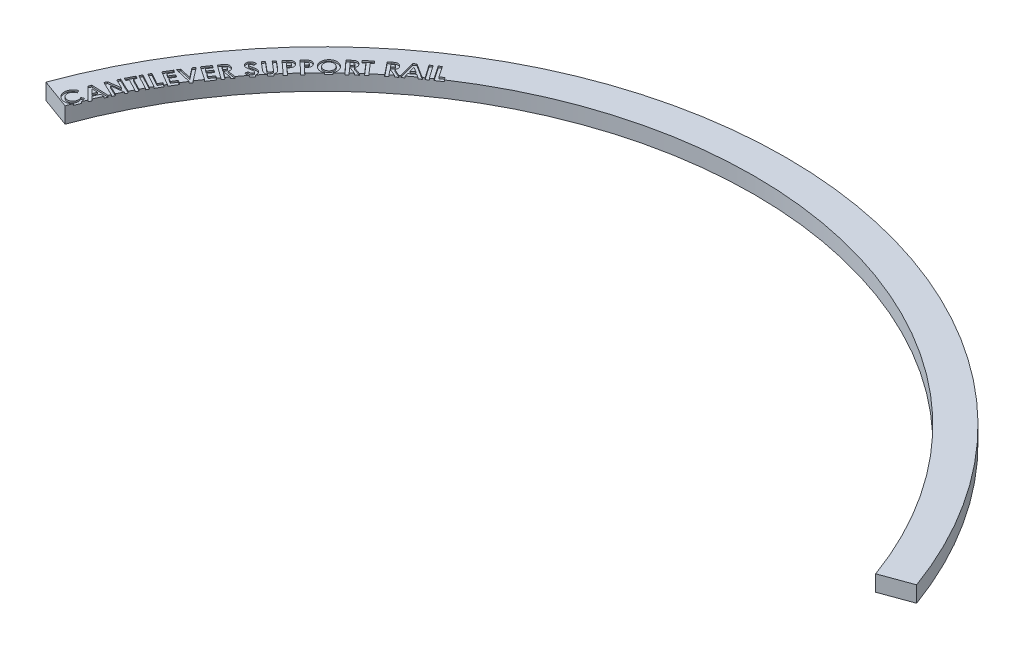
from build123d import *

# Parameters (mm, degrees)
BOSS_EXTRUDE1_DEPTH = 12.7
CUT_EXTRUDE1_DEPTH  = 1.27


with BuildPart() as part:
    # Sketch1 → Boss-Extrude1 (new body)
    with BuildSketch(Plane(origin=(0, 0, 0), x_dir=(1, 0, 0), z_dir=(0, 1, 0))):
        with BuildLine():
            Line((-346.088792235, 125.966018787), (-322.220599667, 117.278707146))
            ThreePointArc((-322.220599667, 117.278707146), (0, 342.9), (322.220599667, 117.278707146))
            Line((322.220599667, 117.278707146), (346.088792235, 125.966018787))
            ThreePointArc((346.088792235, 125.966018787), (0, 368.3), (-346.088792235, 125.966018787))
        make_face()
    extrude(amount=BOSS_EXTRUDE1_DEPTH)

    # Sketch2 → Cut-Extrude1 (cut)
    # profile 1 of 21: a face of its own
    with BuildSketch(Plane(origin=(0, 12.7, 0), x_dir=(1, 0, 0), z_dir=(0, 1, 0))):
        with BuildLine():
            Line((-327.240050789, 133.240205544), (-326.347082039, 131.08792189))
            add(Edge.make_bspline(
                [(-326.347082039, 131.08792189), (-326.533576349, 131.006455917), (-326.898014242, 130.847259168), (-327.405952395, 130.557291605), (-327.867090749, 130.236773155), (-328.27919524, 129.88071122), (-328.645174833, 129.494147103), (-328.960230288, 129.071770204), (-329.231837871, 128.618914855), (-329.36740769, 128.29304351), (-329.435583642, 128.129167884)],
                knots=[0, 0, 0, 0, 1.108760181, 2.166683935, 3.182414968, 4.165710305, 5.130476593, 6.078168, 7.033540604, 8, 8, 8, 8], degree=3))
            add(Edge.make_bspline(
                [(-329.435583642, 128.129167884), (-329.485956587, 127.98927305), (-329.585079401, 127.713990958), (-329.682229684, 127.291386266), (-329.743783374, 126.87360138), (-329.755052747, 126.457251824), (-329.726863801, 126.044171553), (-329.659723244, 125.632416644), (-329.541287363, 125.225614219), (-329.389328213, 124.824130749), (-329.195321735, 124.440810278), (-328.976092531, 124.078983957), (-328.718268106, 123.751819338), (-328.432079104, 123.452743406), (-328.116407213, 123.181354521), (-327.766135575, 122.944298119), (-327.387647445, 122.734160909), (-327.117446656, 122.622072636), (-326.980555597, 122.565285672)],
                knots=[0, 0, 0, 0, 1.051327752, 2.06878049, 3.062580169, 4.035209371, 5.009614187, 5.989271401, 6.980912635, 8.002885837, 9.022707255, 10.016959793, 10.99171565, 11.96367816, 12.942636682, 13.931350166, 14.951965803, 16, 16, 16, 16], degree=3))
            add(Edge.make_bspline(
                [(-326.980555597, 122.565285672), (-326.786941462, 122.497534046), (-326.408036175, 122.364943265), (-325.825028608, 122.254098005), (-325.251319029, 122.216139101), (-324.780723673, 122.25138289), (-324.413720597, 122.314215688), (-324.146146698, 122.38530296), (-323.883017638, 122.467061172), (-323.629894483, 122.57276871), (-323.382460119, 122.692452371), (-323.14382551, 122.83372949), (-322.909766246, 122.990093782), (-322.610688276, 123.226310864), (-322.262599485, 123.555146589), (-321.900759728, 124.006977094), (-321.59150435, 124.507138782), (-321.436657148, 124.871316479), (-321.358159764, 125.055930704)],
                knots=[0, 0, 0, 0, 1.427589606, 2.793810731, 4.119924572, 5.423254632, 6.071185623, 6.711773999, 7.350834564, 7.989430606, 8.620990168, 9.264487668, 9.919998623, 10.580734758, 11.918121045, 13.245997584, 14.60390126, 16, 16, 16, 16], degree=3))
            add(Edge.make_bspline(
                [(-321.358159764, 125.055930704), (-321.300135758, 125.217639294), (-321.186323729, 125.53482496), (-321.081996838, 126.023028796), (-321.022482983, 126.505988231), (-321.024114413, 126.90952417), (-321.050590622, 127.23627958), (-321.08903288, 127.492915625), (-321.146991965, 127.761454578), (-321.216742464, 128.043041758), (-321.307712155, 128.33591295), (-321.411564195, 128.641822115), (-321.533855303, 128.960047714), (-321.626222471, 129.174249422), (-321.673624507, 129.284175896)],
                knots=[0, 0, 0, 0, 1.414032219, 2.773574057, 4.102998339, 5.416519823, 6.089579107, 6.802987462, 7.552533178, 8.352363461, 9.192235755, 10.078240111, 11.013769348, 12, 12, 12, 12], degree=3))
            Line((-321.673624507, 129.284175896), (-319.493356078, 130.19495314))
            add(Edge.make_bspline(
                [(-319.493356078, 130.19495314), (-319.432306776, 130.047739768), (-319.312666486, 129.759240962), (-319.151522281, 129.330689657), (-319.017548518, 128.914009531), (-318.900426085, 128.512799253), (-318.813442848, 128.123080384), (-318.741902932, 127.749402357), (-318.699798263, 127.38883208), (-318.675801056, 127.03985273), (-318.673358685, 126.695778973), (-318.691351378, 126.350047435), (-318.730326961, 126.000369373), (-318.785583208, 125.646026911), (-318.86299391, 125.287854358), (-318.960014154, 124.925711192), (-319.073763993, 124.557561836), (-319.164789389, 124.314331352), (-319.210964251, 124.19094673)],
                knots=[0, 0, 0, 0, 1.234967501, 2.420205749, 3.546559319, 4.626144769, 5.657554192, 6.639722168, 7.573012089, 8.468689078, 9.349292802, 10.237635295, 11.149841904, 12.07464878, 13.015542472, 13.987878246, 14.979301945, 16, 16, 16, 16], degree=3))
            add(Edge.make_bspline(
                [(-319.210964251, 124.19094673), (-319.303025591, 123.968730948), (-319.483568928, 123.53293913), (-319.814155154, 122.919202545), (-320.187233991, 122.357846153), (-320.60626267, 121.851194025), (-321.061099878, 121.391001717), (-321.566865187, 120.991594138), (-322.11171299, 120.640512115), (-322.693918316, 120.344680091), (-323.30252608, 120.108787674), (-323.925355626, 119.936479528), (-324.558431493, 119.834307297), (-325.200345198, 119.799799683), (-325.852550609, 119.826871555), (-326.514429137, 119.925921468), (-327.18554636, 120.091072762), (-327.626297739, 120.248779451), (-327.850627712, 120.329047691)],
                knots=[0, 0, 0, 0, 1.086668448, 2.131087251, 3.14530151, 4.128353758, 5.098686764, 6.064283892, 7.035040782, 8.024172257, 9.010775273, 9.980676634, 10.939792684, 11.903402036, 12.88175745, 13.885164845, 14.923608779, 16, 16, 16, 16], degree=3))
            add(Edge.make_bspline(
                [(-327.850627712, 120.329047691), (-327.994702083, 120.387526013), (-328.279729896, 120.503215905), (-328.689204476, 120.70492337), (-329.077496645, 120.926740639), (-329.443324332, 121.168587932), (-329.789688283, 121.427778989), (-330.109112312, 121.712255749), (-330.412138487, 122.011923907), (-330.688084612, 122.336029619), (-330.942430898, 122.675243531), (-331.170274617, 123.032034362), (-331.373104821, 123.402720566), (-331.553153908, 123.788861819), (-331.703675854, 124.191199328), (-331.835951622, 124.60640019), (-331.935592624, 125.038245917), (-332.01502845, 125.48038852), (-332.066255251, 125.929891996), (-332.085855793, 126.379503956), (-332.078620679, 126.826451924), (-332.042517504, 127.269933277), (-331.980174603, 127.710575086), (-331.883496728, 128.147473413), (-331.764253447, 128.582960145), (-331.658705111, 128.866806786), (-331.605675789, 129.009416281)],
                knots=[0, 0, 0, 0, 1.060195787, 2.097425703, 3.110360843, 4.108123557, 5.086726685, 6.057918386, 7.023081055, 7.99104697, 8.958079373, 9.912682834, 10.875555342, 11.838167259, 12.815658834, 13.803464982, 14.807910485, 15.83581039, 16.866034485, 17.890789188, 18.903080162, 19.912690968, 20.92365929, 21.93555365, 22.962786209, 24, 24, 24, 24], degree=3))
            add(Edge.make_bspline(
                [(-331.605675789, 129.009416281), (-331.55707032, 129.130459189), (-331.460396816, 129.37120662), (-331.290414138, 129.720309905), (-331.105292849, 130.060120105), (-330.898820126, 130.386877965), (-330.676750334, 130.703837105), (-330.437423729, 131.010455174), (-330.177123259, 131.304043375), (-329.903826558, 131.589352526), (-329.614017752, 131.858411434), (-329.310936182, 132.110809354), (-328.994869581, 132.345039096), (-328.667506907, 132.561636808), (-328.327032999, 132.756577728), (-327.97845242, 132.939996796), (-327.614110075, 133.09868934), (-327.365107794, 133.192893277), (-327.240050789, 133.240205544)],
                knots=[0, 0, 0, 0, 0.998053449, 1.98507131, 2.969803044, 3.95846279, 4.941631779, 5.931015647, 6.933596394, 7.943462034, 8.953828145, 9.958549592, 10.960710057, 11.963416854, 12.960900307, 13.962430021, 14.976666403, 16, 16, 16, 16], degree=3))
        make_face()
    # profile 2 of 21: a face of its own
    with BuildSketch(Plane(origin=(0, 12.7, 0), x_dir=(1, 0, 0), z_dir=(0, 1, 0))):
        Polygon((-326.767099015, 139.892128098), (-325.80035222, 142.125822009), (-312.296425938, 141.571214637), (-313.286069367, 139.281551175), (-316.061650297, 139.40621063), (-318.104538919, 134.684415759), (-316.130340201, 132.710217041), (-317.11998363, 130.420553579), align=None)
        Polygon((-323.207944367, 139.696234669), (-319.900652701, 136.434736271), (-318.567559752, 139.513061592), align=None, mode=Mode.SUBTRACT)
    # profile 3 of 21: a face of its own
    with BuildSketch(Plane(origin=(0, 12.7, 0), x_dir=(1, 0, 0), z_dir=(0, 1, 0))):
        Polygon((-322.843899855, 148.703641282), (-321.856800496, 150.771970609), (-312.072305304, 152.077078782), (-319.536608188, 155.63623343), (-318.506259631, 157.796149295), (-307.162249214, 152.384911314), (-308.149348573, 150.311493846), (-317.910947131, 149.001297532), (-310.469540881, 145.452319167), (-311.499889438, 143.292403302), align=None)
    # profile 4 of 21: a face of its own
    with BuildSketch(Plane(origin=(0, 12.7, 0), x_dir=(1, 0, 0), z_dir=(0, 1, 0))):
        Polygon((-317.638394433, 159.712022148), (-314.435409657, 165.917010129), (-312.328919273, 164.83069202), (-313.384708536, 162.785259327), (-304.264215747, 158.076184808), (-305.383606773, 155.908636731), (-314.504099561, 160.617711251), (-315.531904048, 158.625704039), align=None)
    # profile 5 of 21: a face of its own
    with BuildSketch(Plane(origin=(0, 12.7, 0), x_dir=(1, 0, 0), z_dir=(0, 1, 0))):
        Polygon((-313.657843545, 167.35252087), (-312.525732166, 169.453923113), (-301.415776237, 163.472813338), (-302.547887615, 161.371411094), align=None)
    # profile 6 of 21: a face of its own
    with BuildSketch(Plane(origin=(0, 12.7, 0), x_dir=(1, 0, 0), z_dir=(0, 1, 0))):
        Polygon((-311.122814513, 171.982993518), (-309.947453936, 174.07421948), (-300.949076532, 169.024239512), (-299.236917077, 172.074580056), (-297.242365795, 170.955189031), (-300.129885827, 165.813622524), align=None)
    # profile 7 of 21: a face of its own
    with BuildSketch(Plane(origin=(0, 12.7, 0), x_dir=(1, 0, 0), z_dir=(0, 1, 0))):
        Polygon((-307.139536895, 179.075609285), (-303.615999234, 185.013469862), (-301.590919106, 183.81266858), (-303.895846991, 179.930416977), (-301.929280484, 178.762688612), (-299.6243526, 182.644940214), (-297.634889459, 181.461947426), (-299.939817343, 177.579695823), (-297.077738016, 175.880256721), (-294.772810132, 179.762508323), (-292.740097792, 178.5566189), (-296.263635452, 172.618758323), align=None)
    # profile 8 of 21: a face of its own
    with BuildSketch(Plane(origin=(0, 12.7, 0), x_dir=(1, 0, 0), z_dir=(0, 1, 0))):
        Polygon((-302.729985797, 186.387821602), (-301.40198099, 188.471415352), (-292.136476182, 186.33185205), (-297.967485797, 193.862300768), (-296.64202506, 195.945894518), (-288.442485797, 185.334576409), (-289.686536278, 183.380730256), align=None)
    # profile 9 of 21: a face of its own
    with BuildSketch(Plane(origin=(0, 12.7, 0), x_dir=(1, 0, 0), z_dir=(0, 1, 0))):
        Polygon((-295.279942548, 197.933555814), (-291.405323156, 203.614465269), (-289.466741426, 202.291548602), (-292.000635656, 198.577205653), (-290.118023477, 197.292450044), (-287.584129246, 201.006792993), (-285.681164503, 199.709317032), (-288.215058733, 195.994974083), (-285.477638862, 194.127626326), (-282.943744631, 197.841969275), (-280.997530689, 196.513964467), (-284.87215008, 190.833055012), align=None)
    # profile 10 of 21: a face of its own
    with BuildSketch(Plane(origin=(0, 12.7, 0), x_dir=(1, 0, 0), z_dir=(0, 1, 0))):
        with BuildLine():
            Line((-289.781049484, 205.851150073), (-288.287680093, 207.906759048))
            add(Edge.make_bspline(
                [(-288.287680093, 207.906759048), (-288.188242426, 208.041219689), (-287.996505561, 208.300488262), (-287.709811974, 208.666862501), (-287.434499709, 208.995717757), (-287.173574884, 209.288801374), (-286.924689327, 209.54430771), (-286.687373625, 209.761323391), (-286.464808706, 209.944029908), (-286.248320489, 210.089536937), (-286.036716248, 210.209317847), (-285.820415937, 210.305529097), (-285.600274732, 210.388556073), (-285.372128471, 210.447692563), (-285.139842619, 210.496107268), (-284.900323437, 210.518883494), (-284.654761535, 210.531147717), (-284.319611057, 210.515550701), (-283.895299453, 210.456404481), (-283.393972216, 210.298654467), (-282.8989242, 210.067175375), (-282.591408226, 209.858287332), (-282.433773843, 209.751210169)],
                knots=[0, 0, 0, 0, 1.419960084, 2.737983553, 3.949417981, 5.061064723, 6.069250762, 6.976468474, 7.790645228, 8.511604153, 9.188613188, 9.852475166, 10.519958979, 11.183703793, 11.851653509, 12.532328685, 13.224185511, 13.937625959, 15.378554625, 16.847634656, 18.384080147, 20, 20, 20, 20], degree=3))
            add(Edge.make_bspline(
                [(-282.433773843, 209.751210169), (-282.353214497, 209.69035591), (-282.194970807, 209.570819158), (-281.976010492, 209.376567052), (-281.776817877, 209.175416261), (-281.598032394, 208.967044269), (-281.441653766, 208.75031184), (-281.309807437, 208.524216689), (-281.193482471, 208.293422381), (-281.102625314, 208.052541714), (-281.030119943, 207.805341739), (-280.982611082, 207.549537328), (-280.95473388, 207.28672065), (-280.946494836, 207.016159001), (-280.963163616, 206.73815145), (-280.998648969, 206.451583091), (-281.057094574, 206.157531729), (-281.111311065, 205.961082421), (-281.138841952, 205.861326355)],
                knots=[0, 0, 0, 0, 1.096733133, 2.154326055, 3.1773508, 4.170856757, 5.134953013, 6.076862685, 7.012349657, 7.939905927, 8.870250196, 9.808230052, 10.762766542, 11.739941671, 12.74589109, 13.78599658, 14.875739133, 16, 16, 16, 16], degree=3))
            Line((-281.138841952, 205.861326355), (-274.867708138, 204.981077958))
            Line((-274.867708138, 204.981077958), (-276.404326727, 202.864411291))
            Line((-276.404326727, 202.864411291), (-282.377804292, 203.706498631))
            Line((-282.377804292, 203.706498631), (-282.507551888, 203.528413695))
            Line((-282.507551888, 203.528413695), (-278.197896439, 200.396662894))
            Line((-278.197896439, 200.396662894), (-279.607311503, 198.458081163))
            Line((-279.607311503, 198.458081163), (-289.781049484, 205.851150073))
        make_face()
        with BuildLine():
            Line((-284.395252208, 204.899667701), (-283.952583939, 205.507700554))
            add(Edge.make_bspline(
                [(-283.952583939, 205.507700554), (-283.899532112, 205.582851309), (-283.798048755, 205.72660792), (-283.659354677, 205.938815622), (-283.541329453, 206.138415192), (-283.448815681, 206.327753361), (-283.368502962, 206.500617067), (-283.316760629, 206.664436687), (-283.277991795, 206.814370795), (-283.26114777, 206.997971515), (-283.287503006, 207.218579549), (-283.390934078, 207.470389943), (-283.57440285, 207.699934554), (-283.733469484, 207.826813872), (-283.817748202, 207.894038695)],
                knots=[0, 0, 0, 0, 1.202832052, 2.300909128, 3.314666972, 4.232145169, 5.056351339, 5.80330458, 6.475748144, 7.07713861, 8.20504816, 9.343862454, 10.59269124, 12, 12, 12, 12], degree=3))
            add(Edge.make_bspline(
                [(-283.817748202, 207.894038695), (-283.872766223, 207.930445747), (-283.98041277, 208.001678652), (-284.155362178, 208.079021674), (-284.335982568, 208.125118414), (-284.519621543, 208.142884633), (-284.702422342, 208.133005075), (-284.880441276, 208.09478941), (-285.050130752, 208.026338778), (-285.187642724, 207.949600726), (-285.298613443, 207.869649524), (-285.387519674, 207.78820133), (-285.486784634, 207.692289756), (-285.59309637, 207.577086328), (-285.707763246, 207.445508493), (-285.826664195, 207.293404207), (-285.956925546, 207.126515742), (-286.044143477, 207.007259225), (-286.08960317, 206.945100394)],
                knots=[0, 0, 0, 0, 1.12432441, 2.199818149, 3.245700022, 4.292482439, 5.335959061, 6.357738569, 7.38422064, 8.446786831, 9.037243688, 9.713803397, 10.501743855, 11.392468265, 12.387565934, 13.479099725, 14.686057435, 16, 16, 16, 16], degree=3))
            Line((-286.08960317, 206.945100394), (-286.476301888, 206.413389657))
            Line((-286.476301888, 206.413389657), (-284.395252208, 204.899667701))
        make_face(mode=Mode.SUBTRACT)
    # profile 11 of 21: a face of its own
    with BuildSketch(Plane(origin=(0, 12.7, 0), x_dir=(1, 0, 0), z_dir=(0, 1, 0))):
        with BuildLine():
            Line((-275.130264086, 222.508663829), (-275.00051649, 220.1299579))
            add(Edge.make_bspline(
                [(-275.00051649, 220.1299579), (-275.129424157, 220.134652183), (-275.377233101, 220.143676358), (-275.733673912, 220.122360149), (-276.059531041, 220.07886683), (-276.353690914, 220.004813678), (-276.617899854, 219.907070718), (-276.849616929, 219.780850686), (-277.053690985, 219.631103843), (-277.162462585, 219.507097226), (-277.216401907, 219.445602932)],
                knots=[0, 0, 0, 0, 1.286006536, 2.472187498, 3.557207052, 4.560436619, 5.492070806, 6.358893645, 7.186183128, 8, 8, 8, 8], degree=3))
            add(Edge.make_bspline(
                [(-277.216401907, 219.445602932), (-277.260567506, 219.383994418), (-277.345428948, 219.265617508), (-277.440662062, 219.074534567), (-277.492363509, 218.877885966), (-277.503996966, 218.682903973), (-277.485440622, 218.499111187), (-277.434983703, 218.334683523), (-277.352108523, 218.19429895), (-277.275124977, 218.122737351), (-277.236754471, 218.087069278)],
                knots=[0, 0, 0, 0, 1.210306979, 2.325529264, 3.390546432, 4.436247087, 5.431464978, 6.327229767, 7.166249885, 8, 8, 8, 8], degree=3))
            add(Edge.make_bspline(
                [(-277.236754471, 218.087069278), (-277.193598264, 218.056602437), (-277.107207658, 217.995613555), (-276.95920254, 217.932982602), (-276.799856383, 217.890038514), (-276.688378661, 217.884061664), (-276.631265689, 217.880999566)],
                knots=[0, 0, 0, 0, 0.972018067, 1.945797266, 2.947577858, 4, 4, 4, 4], degree=3))
            add(Edge.make_bspline(
                [(-276.631265689, 217.880999566), (-276.5837553, 217.88227663), (-276.474142477, 217.885222985), (-276.288226983, 217.901618637), (-276.057612789, 217.930693804), (-275.782743871, 217.971139084), (-275.463132873, 218.025426728), (-275.100435991, 218.092204847), (-274.692265143, 218.167997353), (-274.405986585, 218.224957276), (-274.25510383, 218.254977932)],
                knots=[0, 0, 0, 0, 0.473668386, 1.092816336, 1.859245285, 2.790493068, 3.861922217, 5.090514929, 6.466559537, 8, 8, 8, 8], degree=3))
            add(Edge.make_bspline(
                [(-274.25510383, 218.254977932), (-274.115176676, 218.283788427), (-273.849821761, 218.338424045), (-273.472929757, 218.416376903), (-273.136472674, 218.478399747), (-272.84251404, 218.535133527), (-272.590641101, 218.580959769), (-272.381238985, 218.616978088), (-272.21423434, 218.64320837), (-272.116419564, 218.654629611), (-272.0748354, 218.659485143)],
                knots=[0, 0, 0, 0, 1.545884822, 2.9315835, 4.164375646, 5.247790219, 6.171128417, 6.934465452, 7.547007459, 8, 8, 8, 8], degree=3))
            add(Edge.make_bspline(
                [(-272.0748354, 218.659485143), (-271.908768281, 218.674631476), (-271.589788068, 218.703724416), (-271.128596667, 218.70694886), (-270.706522855, 218.67378995), (-270.320466317, 218.598530475), (-269.959210362, 218.487738823), (-269.615411758, 218.335916901), (-269.280679754, 218.147573417), (-269.073767524, 217.992796835), (-268.968525304, 217.914072483)],
                knots=[0, 0, 0, 0, 1.216962663, 2.337530824, 3.362698065, 4.302449856, 5.203219007, 6.115320098, 7.041391136, 8, 8, 8, 8], degree=3))
            add(Edge.make_bspline(
                [(-268.968525304, 217.914072483), (-268.87093916, 217.832881692), (-268.678752382, 217.672984028), (-268.424828298, 217.40357429), (-268.201486414, 217.121231043), (-268.014497031, 216.821800237), (-267.86316498, 216.505898394), (-267.746369555, 216.173928968), (-267.661562564, 215.826370869), (-267.614278241, 215.466441569), (-267.601585373, 215.100948241), (-267.624015905, 214.735204864), (-267.684918121, 214.373474982), (-267.786390329, 214.015972071), (-267.923596418, 213.662058193), (-268.101512333, 213.312083929), (-268.314720576, 212.965346561), (-268.48156329, 212.744893192), (-268.566562163, 212.632582098)],
                knots=[0, 0, 0, 0, 1.024857106, 2.018360162, 2.984674886, 3.929570051, 4.864274677, 5.809120157, 6.767997359, 7.74961598, 8.736861882, 9.718600059, 10.705346529, 11.694516449, 12.716253879, 13.767276755, 14.862527746, 16, 16, 16, 16], degree=3))
            add(Edge.make_bspline(
                [(-268.566562163, 212.632582098), (-268.637666647, 212.546932097), (-268.777744603, 212.378199037), (-269.001787632, 212.143202883), (-269.237109178, 211.931392038), (-269.480704658, 211.740383989), (-269.734297976, 211.571357472), (-269.99710324, 211.423466537), (-270.26959462, 211.295450684), (-270.553032273, 211.190883092), (-270.847676209, 211.10947309), (-271.153815957, 211.048904939), (-271.472403056, 211.006712954), (-271.804213072, 210.993632711), (-272.149024663, 210.998808113), (-272.50671119, 211.024085868), (-272.877965464, 211.072570993), (-273.127476577, 211.121686428), (-273.255284118, 211.146844919)],
                knots=[0, 0, 0, 0, 1.023346102, 2.016022367, 2.982161224, 3.932053829, 4.859798653, 5.781494761, 6.702398977, 7.625051048, 8.55580549, 9.510008627, 10.492620137, 11.507345105, 12.560092915, 13.662270397, 14.802540415, 16, 16, 16, 16], degree=3))
            Line((-273.255284118, 211.146844919), (-272.955083798, 213.492477932))
            add(Edge.make_bspline(
                [(-272.955083798, 213.492477932), (-272.804417532, 213.469557533), (-272.515973015, 213.42567735), (-272.097147382, 213.403201204), (-271.712827124, 213.414062082), (-271.364685903, 213.474143483), (-271.049443809, 213.565688856), (-270.771909797, 213.701862671), (-270.527509215, 213.876592326), (-270.397416253, 214.024007037), (-270.332147099, 214.097966714)],
                knots=[0, 0, 0, 0, 1.2934333, 2.476226128, 3.55728731, 4.550573024, 5.468649002, 6.334994529, 7.164647367, 8, 8, 8, 8], degree=3))
            add(Edge.make_bspline(
                [(-270.332147099, 214.097966714), (-270.273538855, 214.179384205), (-270.159671756, 214.33756628), (-270.036550786, 214.597490291), (-269.973238418, 214.867940376), (-269.957739185, 215.138341257), (-269.989043823, 215.397582955), (-270.066314034, 215.631996432), (-270.185275044, 215.83886088), (-270.30181353, 215.941790879), (-270.360131875, 215.993299246)],
                knots=[0, 0, 0, 0, 1.146201061, 2.226898164, 3.264546251, 4.304187726, 5.311321561, 6.231642602, 7.115076236, 8, 8, 8, 8], degree=3))
            add(Edge.make_bspline(
                [(-270.360131875, 215.993299246), (-270.418996257, 216.034672538), (-270.53898458, 216.119007269), (-270.749988261, 216.20365834), (-270.983776646, 216.260422284), (-271.19848937, 216.27704179), (-271.391466483, 216.27716696), (-271.564661459, 216.266005386), (-271.764032734, 216.245255112), (-271.988578507, 216.213781985), (-272.240115708, 216.176754377), (-272.516746643, 216.123491212), (-272.820891437, 216.066910594), (-273.031507752, 216.021797507), (-273.140800945, 215.998387387)],
                knots=[0, 0, 0, 0, 0.901796787, 1.838209768, 2.836183557, 3.917074742, 4.535334769, 5.261444347, 6.097259238, 7.054553291, 8.111365551, 9.292665107, 10.595107531, 12, 12, 12, 12], degree=3))
            add(Edge.make_bspline(
                [(-273.140800945, 215.998387387), (-273.350101827, 215.953511172), (-273.752761826, 215.867176816), (-274.334663823, 215.75540689), (-274.868966261, 215.663467085), (-275.355564066, 215.590322335), (-275.795259964, 215.54208854), (-276.188138356, 215.512864184), (-276.533821113, 215.503632289), (-276.838091085, 215.516012804), (-277.112749751, 215.546789184), (-277.368839679, 215.59631216), (-277.614271053, 215.655845812), (-277.846326982, 215.73396942), (-278.069187887, 215.820869005), (-278.276964041, 215.929468839), (-278.47544617, 216.048480402), (-278.597741981, 216.140592537), (-278.658889887, 216.186648605)],
                knots=[0, 0, 0, 0, 1.800679851, 3.464207791, 4.984164685, 6.361288664, 7.602861248, 8.704269373, 9.674705649, 10.510125038, 11.264052604, 11.997207196, 12.703131575, 13.386677142, 14.055661107, 14.712902887, 15.356451444, 16, 16, 16, 16], degree=3))
            add(Edge.make_bspline(
                [(-278.658889887, 216.186648605), (-278.741892326, 216.256167586), (-278.90500033, 216.39277926), (-279.120531564, 216.625916161), (-279.30917414, 216.874106702), (-279.46787261, 217.14156808), (-279.599226852, 217.424975631), (-279.696373048, 217.727240618), (-279.772587273, 218.044939779), (-279.813435287, 218.377586239), (-279.827512105, 218.715639639), (-279.805965216, 219.051189498), (-279.756452299, 219.379611361), (-279.671166119, 219.700873887), (-279.552655376, 220.014451182), (-279.405852267, 220.322950969), (-279.223448783, 220.623268511), (-279.080383003, 220.812133179), (-279.007427548, 220.908443477)],
                knots=[0, 0, 0, 0, 0.985340335, 1.936291231, 2.884854851, 3.820115751, 4.763697021, 5.723671637, 6.707345319, 7.735389679, 8.771182064, 9.784966008, 10.793320719, 11.791953901, 12.806326228, 13.842809641, 14.899954938, 16, 16, 16, 16], degree=3))
            add(Edge.make_bspline(
                [(-279.007427548, 220.908443477), (-278.905949076, 221.028146581), (-278.704131411, 221.266208905), (-278.351727706, 221.575093809), (-277.963466391, 221.838183417), (-277.613201296, 222.024431949), (-277.308556072, 222.149883408), (-277.057355758, 222.232357846), (-276.785748361, 222.306674344), (-276.494525939, 222.369845597), (-276.181878528, 222.42020216), (-275.849998284, 222.460192857), (-275.497038699, 222.491249662), (-275.254978087, 222.502742508), (-275.130264086, 222.508663829)],
                knots=[0, 0, 0, 0, 1.299124431, 2.583663845, 3.868203259, 5.179078547, 5.862929183, 6.596299176, 7.368603969, 8.195658382, 9.064474184, 9.991935646, 10.965408962, 12, 12, 12, 12], degree=3))
        make_face()
    # profile 12 of 21: a face of its own
    with BuildSketch(Plane(origin=(0, 12.7, 0), x_dir=(1, 0, 0), z_dir=(0, 1, 0))):
        with BuildLine():
            Line((-274.734355045, 225.721625367), (-273.17229575, 227.576252771))
            Line((-273.17229575, 227.576252771), (-266.890985654, 222.287130175))
            add(Edge.make_bspline(
                [(-266.890985654, 222.287130175), (-266.825120167, 222.232510855), (-266.698793441, 222.127753719), (-266.511989062, 221.982056615), (-266.337525065, 221.852717155), (-266.174540315, 221.739447349), (-266.021149625, 221.645261007), (-265.879868659, 221.56620062), (-265.749497226, 221.503541533), (-265.590901252, 221.446221266), (-265.396712492, 221.404055337), (-265.162373183, 221.387252142), (-264.925795361, 221.412392295), (-264.687319878, 221.469856954), (-264.454184261, 221.570979209), (-264.227207402, 221.706223128), (-264.015247575, 221.884668737), (-263.888239008, 222.024380863), (-263.822836616, 222.096324886)],
                knots=[0, 0, 0, 0, 1.157533994, 2.220092583, 3.204461228, 4.095487545, 4.904200431, 5.638533096, 6.285181891, 6.85857977, 7.916296389, 8.962565047, 10.023077808, 11.122169415, 12.268563403, 13.44711292, 14.685404237, 16, 16, 16, 16], degree=3))
            add(Edge.make_bspline(
                [(-263.822836616, 222.096324886), (-263.759290259, 222.176885108), (-263.635708528, 222.333554541), (-263.496044433, 222.591270503), (-263.394082039, 222.853468112), (-263.335794722, 223.120520469), (-263.318138179, 223.383641838), (-263.33674671, 223.637364177), (-263.399147331, 223.875049493), (-263.481437868, 224.063842846), (-263.574156685, 224.214073219), (-263.668365602, 224.338750648), (-263.783845102, 224.477915901), (-263.924687103, 224.626678739), (-264.086779737, 224.789554448), (-264.27476889, 224.962894991), (-264.483927925, 225.149875936), (-264.633256, 225.27674687), (-264.710717225, 225.342558861)],
                knots=[0, 0, 0, 0, 1.26299243, 2.456203633, 3.597918483, 4.721733, 5.811524262, 6.839532932, 7.843713108, 8.826715532, 9.366446159, 10.016767223, 10.751680144, 11.594986718, 12.541274925, 13.58432572, 14.746912865, 16, 16, 16, 16], degree=3))
            Line((-264.710717225, 225.342558861), (-270.760516904, 230.438332098))
            Line((-270.760516904, 230.438332098), (-269.198457609, 232.292959502))
            Line((-269.198457609, 232.292959502), (-263.413241263, 227.42106447))
            add(Edge.make_bspline(
                [(-263.413241263, 227.42106447), (-263.295941339, 227.321315357), (-263.071072395, 227.130092065), (-262.752223661, 226.850243202), (-262.466833672, 226.588523436), (-262.214447688, 226.343779107), (-261.993497814, 226.11847378), (-261.803858197, 225.912510648), (-261.647395101, 225.724722796), (-261.48311708, 225.495779203), (-261.316489366, 225.205042609), (-261.153307512, 224.832178856), (-261.034345484, 224.423841925), (-260.948218785, 223.991545899), (-260.904519574, 223.548330357), (-260.909311301, 223.108100124), (-260.962142072, 222.677524927), (-261.06780524, 222.25652858), (-261.225772541, 221.843342941), (-261.434071911, 221.432976885), (-261.696993016, 221.02548635), (-261.904736761, 220.766519969), (-262.01145841, 220.633484342)],
                knots=[0, 0, 0, 0, 1.158427517, 2.220754816, 3.191546841, 4.071366309, 4.865417083, 5.565390738, 6.177241714, 6.703081414, 7.68357357, 8.692223464, 9.757974579, 10.876573757, 12.004684619, 13.102123568, 14.182309551, 15.260836203, 16.359276143, 17.503437659, 18.717471604, 20, 20, 20, 20], degree=3))
            add(Edge.make_bspline(
                [(-262.01145841, 220.633484342), (-262.085778037, 220.547612325), (-262.231937441, 220.378733613), (-262.467945038, 220.147292408), (-262.708905092, 219.935173577), (-262.959796456, 219.745533769), (-263.219185623, 219.578848647), (-263.484525973, 219.428706451), (-263.760276392, 219.304821412), (-264.041191442, 219.201653492), (-264.322919647, 219.116492222), (-264.604087929, 219.05671685), (-264.879972596, 219.012434234), (-265.152890024, 218.989439013), (-265.420929185, 218.985586233), (-265.685248917, 219.007736405), (-265.945525432, 219.04539704), (-266.207971138, 219.103469549), (-266.4781592, 219.19666882), (-266.766177468, 219.321527174), (-267.074128602, 219.488026821), (-267.407513697, 219.685191879), (-267.761388541, 219.924828904), (-268.139120594, 220.19864985), (-268.538894725, 220.510088865), (-268.808957281, 220.733673974), (-268.949138699, 220.849730335)],
                knots=[0, 0, 0, 0, 1.023941046, 2.013715883, 2.978618556, 3.917897319, 4.847156823, 5.757975543, 6.665093367, 7.570177329, 8.455921334, 9.317083513, 10.160882737, 10.974573696, 11.785383559, 12.575583672, 13.364153282, 14.156460648, 14.995775891, 15.937853373, 16.984846573, 18.151007827, 19.430212584, 20.837780544, 22.358586199, 24, 24, 24, 24], degree=3))
            Line((-268.949138699, 220.849730335), (-274.734355045, 225.721625367))
        make_face()
    # profile 13 of 21: a face of its own
    with BuildSketch(Plane(origin=(0, 12.7, 0), x_dir=(1, 0, 0), z_dir=(0, 1, 0))):
        with BuildLine():
            Line((-267.181009554, 234.642065023), (-265.471394169, 236.555206049))
            add(Edge.make_bspline(
                [(-265.471394169, 236.555206049), (-265.359638243, 236.679984037), (-265.144243055, 236.92047758), (-264.816615981, 237.252198098), (-264.509199502, 237.554783885), (-264.216108186, 237.82114845), (-263.937107684, 238.051337925), (-263.675797166, 238.24943409), (-263.42720079, 238.40980147), (-263.119651281, 238.576240924), (-262.736065119, 238.727211689), (-262.261374492, 238.826587343), (-261.775538846, 238.852893759), (-261.367069698, 238.808539075), (-261.04038419, 238.73886449), (-260.796055632, 238.663756199), (-260.553792607, 238.573144803), (-260.316034568, 238.459922358), (-260.082224363, 238.32688066), (-259.849842874, 238.176378038), (-259.620312988, 238.006604756), (-259.47499355, 237.87918715), (-259.401241925, 237.814520953)],
                knots=[0, 0, 0, 0, 1.407932573, 2.713609152, 3.918475375, 5.033889893, 6.041587728, 6.958363672, 7.788901926, 8.525699186, 9.895874187, 11.236730424, 12.585974651, 13.969217514, 14.676739322, 15.391656843, 16.115897005, 16.849341321, 17.602713222, 18.375860628, 19.175726805, 20, 20, 20, 20], degree=3))
            add(Edge.make_bspline(
                [(-259.401241925, 237.814520953), (-259.321154522, 237.740274866), (-259.164855539, 237.595375826), (-258.955073685, 237.361150872), (-258.769665855, 237.121800242), (-258.603691153, 236.877690764), (-258.469950252, 236.622359873), (-258.359711177, 236.360969282), (-258.272454882, 236.093965271), (-258.212172117, 235.820299251), (-258.173054903, 235.544695836), (-258.161822501, 235.267119568), (-258.168631467, 234.989865475), (-258.198878805, 234.710464327), (-258.25628252, 234.432042383), (-258.332238767, 234.151653941), (-258.434667875, 233.87254632), (-258.517313917, 233.68924885), (-258.559154586, 233.596452042)],
                knots=[0, 0, 0, 0, 1.126292272, 2.198077705, 3.239431106, 4.24894315, 5.239199106, 6.207724622, 7.173400364, 8.132872557, 9.095570813, 10.041543352, 10.995614533, 11.955086726, 12.936606842, 13.925779874, 14.949898191, 16, 16, 16, 16], degree=3))
            add(Edge.make_bspline(
                [(-258.559154586, 233.596452042), (-258.589698444, 233.537460981), (-258.655639812, 233.41010473), (-258.78148112, 233.214373852), (-258.929726141, 232.992671317), (-259.113395827, 232.751906791), (-259.320130516, 232.484937408), (-259.558408703, 232.197851204), (-259.82273063, 231.886449648), (-260.012173316, 231.674401222), (-260.111037598, 231.563739703)],
                knots=[0, 0, 0, 0, 0.621622152, 1.342024803, 2.176622888, 3.118255631, 4.17600601, 5.337951359, 6.610759096, 8, 8, 8, 8], degree=3))
            Line((-260.111037598, 231.563739703), (-256.0990384, 227.97660028))
            Line((-256.0990384, 227.97660028), (-257.709435034, 226.175398356))
            Line((-257.709435034, 226.175398356), (-267.181009554, 234.642065023))
        make_face()
        with BuildLine():
            Line((-261.868990323, 233.13597528), (-261.355088079, 233.710935215))
            add(Edge.make_bspline(
                [(-261.355088079, 233.710935215), (-261.262041711, 233.815743398), (-261.091484723, 234.00786017), (-260.878545761, 234.286819885), (-260.714364813, 234.518641439), (-260.611634171, 234.723692209), (-260.552568948, 234.908554686), (-260.522896118, 235.085308018), (-260.526631226, 235.262420228), (-260.556658655, 235.437748422), (-260.616576107, 235.608729427), (-260.700782036, 235.775319038), (-260.81925893, 235.92989635), (-260.914574485, 236.022134871), (-260.96330122, 236.069288581)],
                knots=[0, 0, 0, 0, 1.837015784, 3.367309049, 4.601018299, 5.555881583, 6.361244861, 7.138239398, 7.894506042, 8.673328709, 9.461071443, 10.261815008, 11.111413874, 12, 12, 12, 12], degree=3))
            add(Edge.make_bspline(
                [(-260.96330122, 236.069288581), (-261.008100941, 236.107931262), (-261.095373175, 236.183209254), (-261.239123338, 236.270903238), (-261.382643872, 236.341358635), (-261.529407941, 236.39118478), (-261.679723935, 236.416645416), (-261.832973391, 236.418209532), (-261.988052295, 236.401383154), (-262.089767942, 236.373442365), (-262.141205868, 236.359312619)],
                knots=[0, 0, 0, 0, 1.11224511, 2.166712498, 3.159405267, 4.118792003, 5.074317477, 6.016542193, 6.996959083, 8, 8, 8, 8], degree=3))
            add(Edge.make_bspline(
                [(-262.141205868, 236.359312619), (-262.181475134, 236.345015432), (-262.267916353, 236.314325371), (-262.397165279, 236.243796281), (-262.533133881, 236.151096652), (-262.681075925, 236.040230187), (-262.836351844, 235.905729681), (-263.002608267, 235.750308199), (-263.174752003, 235.571148689), (-263.291405952, 235.44370198), (-263.352183432, 235.377301401)],
                knots=[0, 0, 0, 0, 0.650682248, 1.396741775, 2.235806657, 3.158912031, 4.213444911, 5.365904336, 6.627618728, 8, 8, 8, 8], degree=3))
            Line((-263.352183432, 235.377301401), (-263.807572054, 234.868487299))
            Line((-263.807572054, 234.868487299), (-261.868990323, 233.13597528))
        make_face(mode=Mode.SUBTRACT)
    # profile 14 of 21: a face of its own
    with BuildSketch(Plane(origin=(0, 12.7, 0), x_dir=(1, 0, 0), z_dir=(0, 1, 0))):
        with BuildLine():
            Line((-260.295019132, 242.069270547), (-258.54724269, 243.911177598))
            add(Edge.make_bspline(
                [(-258.54724269, 243.911177598), (-258.432568904, 244.030550045), (-258.211119481, 244.261073172), (-257.880923809, 244.583268351), (-257.567486248, 244.873292498), (-257.26858412, 245.125840177), (-256.987582116, 245.3478946), (-256.721794438, 245.533298657), (-256.471472954, 245.685459501), (-256.161752728, 245.841032281), (-255.776351426, 245.977719082), (-255.304157066, 246.06648213), (-254.823033335, 246.075924613), (-254.420859623, 246.019957004), (-254.101192686, 245.938697359), (-253.860819389, 245.860268136), (-253.625129689, 245.760057538), (-253.391203638, 245.644139218), (-253.166123292, 245.500593698), (-252.938382718, 245.347460283), (-252.716485895, 245.171278071), (-252.5763011, 245.040861736), (-252.505075222, 244.974599072)],
                knots=[0, 0, 0, 0, 1.405503895, 2.714203819, 3.916963606, 5.030768858, 6.036229609, 6.957112409, 7.780831683, 8.521519495, 9.897191814, 11.237524619, 12.584418264, 13.965357629, 14.670944676, 15.383697454, 16.109891762, 16.844145873, 17.597536281, 18.374509701, 19.174111758, 20, 20, 20, 20], degree=3))
            add(Edge.make_bspline(
                [(-252.505075222, 244.974599072), (-252.428286462, 244.89951216), (-252.277468992, 244.752037212), (-252.077497674, 244.513479495), (-251.897430842, 244.272046834), (-251.744230494, 244.022932882), (-251.619480703, 243.766481508), (-251.5174664, 243.506175668), (-251.436279809, 243.24056293), (-251.387177069, 242.968011069), (-251.359964836, 242.694092294), (-251.350281322, 242.41925685), (-251.37000438, 242.145403474), (-251.407743904, 241.87057113), (-251.468708265, 241.596491407), (-251.55378956, 241.322931154), (-251.660225519, 241.049598359), (-251.748115667, 240.872088532), (-251.792735478, 240.781970867)],
                knots=[0, 0, 0, 0, 1.120266536, 2.2002669, 3.244684436, 4.261704008, 5.247313567, 6.217018369, 7.177510675, 8.140934546, 9.101753024, 10.049147748, 11.007026688, 11.963309604, 12.942500263, 13.933539127, 14.950905247, 16, 16, 16, 16], degree=3))
            add(Edge.make_bspline(
                [(-251.792735478, 240.781970867), (-251.825176565, 240.724768914), (-251.895686383, 240.600442027), (-252.024108989, 240.408319823), (-252.179471444, 240.193839377), (-252.366932207, 239.960759803), (-252.579848598, 239.703921091), (-252.822882213, 239.426076253), (-253.094342829, 239.126721929), (-253.2874396, 238.921920138), (-253.38786769, 238.815404361)],
                knots=[0, 0, 0, 0, 0.621670962, 1.351184888, 2.183661972, 3.125449021, 4.17887978, 5.338347919, 6.615695987, 8, 8, 8, 8], degree=3))
            Line((-253.38786769, 238.815404361), (-249.523424581, 235.149398752))
            Line((-249.523424581, 235.149398752), (-251.171982273, 233.411798592))
            Line((-251.171982273, 233.411798592), (-260.295019132, 242.069270547))
        make_face()
        with BuildLine():
            Line((-255.079674581, 240.420712854), (-254.555596055, 240.972776156))
            add(Edge.make_bspline(
                [(-254.555596055, 240.972776156), (-254.460981819, 241.073371006), (-254.287483361, 241.257836392), (-254.068201902, 241.526686552), (-253.900881218, 241.752718213), (-253.791888229, 241.952820111), (-253.727919848, 242.13442794), (-253.692717078, 242.309355777), (-253.691894341, 242.484754103), (-253.714269158, 242.658904284), (-253.76468243, 242.830891974), (-253.849306624, 242.99498883), (-253.957722637, 243.154341114), (-254.050259862, 243.247692149), (-254.097663363, 243.295512534)],
                knots=[0, 0, 0, 0, 1.828970422, 3.353866847, 4.594640186, 5.549638645, 6.359825918, 7.13766088, 7.901742255, 8.672403569, 9.457989621, 10.261920528, 11.109644252, 12, 12, 12, 12], degree=3))
            add(Edge.make_bspline(
                [(-254.097663363, 243.295512534), (-254.140715278, 243.33500433), (-254.224397677, 243.411766727), (-254.364365366, 243.502136585), (-254.503444558, 243.578022777), (-254.6483347, 243.630112892), (-254.796967567, 243.657533659), (-254.948341854, 243.66512222), (-255.102559252, 243.6528894), (-255.203735238, 243.62848356), (-255.255215446, 243.616065419)],
                knots=[0, 0, 0, 0, 1.10916348, 2.155942684, 3.158806195, 4.117913134, 5.070078315, 6.022926296, 6.994028434, 8, 8, 8, 8], degree=3))
            add(Edge.make_bspline(
                [(-255.255215446, 243.616065419), (-255.2954448, 243.602557916), (-255.381391291, 243.57370032), (-255.510806108, 243.507587128), (-255.651458108, 243.424352244), (-255.798362382, 243.314344615), (-255.958365456, 243.189641755), (-256.124311912, 243.03859152), (-256.301838414, 242.869994214), (-256.420066286, 242.746511383), (-256.481457433, 242.68239154)],
                knots=[0, 0, 0, 0, 0.653726819, 1.396630084, 2.235572648, 3.172215652, 4.224222728, 5.363665091, 6.63105357, 8, 8, 8, 8], degree=3))
            Line((-256.481457433, 242.68239154), (-256.947022337, 242.193930002))
            Line((-256.947022337, 242.193930002), (-255.079674581, 240.420712854))
        make_face(mode=Mode.SUBTRACT)
    # profile 15 of 21: a face of its own
    with BuildSketch(Plane(origin=(0, 12.7, 0), x_dir=(1, 0, 0), z_dir=(0, 1, 0))):
        with BuildLine():
            add(Edge.make_bspline(
                [(-249.076386972, 253.988161774), (-248.915422714, 254.137186641), (-248.59817195, 254.430905591), (-248.080358514, 254.812231583), (-247.535727921, 255.131291768), (-246.966078139, 255.393143992), (-246.369424682, 255.591372225), (-245.748381379, 255.732570602), (-245.101366494, 255.809679727), (-244.438081618, 255.830203527), (-243.773953535, 255.789383723), (-243.124130116, 255.69190665), (-242.499060431, 255.528792933), (-241.900022267, 255.30215879), (-241.323144028, 255.01942828), (-240.774003096, 254.670144046), (-240.243952019, 254.26597126), (-239.923058523, 253.951873136), (-239.760000754, 253.792268345)],
                knots=[0, 0, 0, 0, 1.015431948, 2.001354618, 2.971415302, 3.934604893, 4.899714688, 5.878325954, 6.879505062, 7.913008488, 8.947944, 9.957310793, 10.951926901, 11.93389042, 12.919351357, 13.921931783, 14.944057228, 16, 16, 16, 16], degree=3))
            add(Edge.make_bspline(
                [(-239.760000754, 253.792268345), (-239.60575435, 253.627193859), (-239.302038767, 253.30215747), (-238.909341764, 252.772350506), (-238.579352874, 252.219383986), (-238.307442051, 251.644822615), (-238.098473893, 251.046929352), (-237.949685593, 250.426484561), (-237.86409669, 249.783754991), (-237.839393542, 249.126211737), (-237.874182723, 248.471276005), (-237.968339625, 247.83315462), (-238.120961673, 247.219070801), (-238.334740243, 246.629345207), (-238.612358456, 246.065366313), (-238.950352031, 245.527796615), (-239.344877175, 245.012286942), (-239.649029253, 244.698559692), (-239.803249952, 244.53948389)],
                knots=[0, 0, 0, 0, 1.051841902, 2.071106815, 3.065036518, 4.047627048, 5.027187032, 6.010309527, 7.014883579, 8.042801506, 9.07144798, 10.065950664, 11.043277484, 12.014332161, 12.982545879, 13.965803304, 14.968557967, 16, 16, 16, 16], degree=3))
            add(Edge.make_bspline(
                [(-239.803249952, 244.53948389), (-239.972448595, 244.381683907), (-240.305362371, 244.071198038), (-240.847795659, 243.671876249), (-241.410569468, 243.335133742), (-241.995773077, 243.064544976), (-242.601573342, 242.85659543), (-243.229470786, 242.715893257), (-243.879381521, 242.643178375), (-244.542091022, 242.634193103), (-245.202946357, 242.684246328), (-245.845052756, 242.793637719), (-246.462513478, 242.958716737), (-247.052520679, 243.18440039), (-247.618202325, 243.465145847), (-248.156702852, 243.805356137), (-248.669161706, 244.204176788), (-248.983229473, 244.507663121), (-249.142532805, 244.661599274)],
                knots=[0, 0, 0, 0, 1.066487208, 2.098410938, 3.099995462, 4.087084019, 5.066805125, 6.049021943, 7.049046984, 8.077941359, 9.101886446, 10.101880885, 11.078285347, 12.045233515, 13.010883212, 13.986535171, 14.978718324, 16, 16, 16, 16], degree=3))
            add(Edge.make_bspline(
                [(-249.142532805, 244.661599274), (-249.244894915, 244.769709445), (-249.448823452, 244.985089425), (-249.726639511, 245.328355529), (-249.981555649, 245.682804304), (-250.203532004, 246.05333173), (-250.406273536, 246.432695428), (-250.582517931, 246.824999426), (-250.729601944, 247.231043971), (-250.851944682, 247.647228908), (-250.945248523, 248.070683709), (-251.011823728, 248.496349721), (-251.050189353, 248.922133295), (-251.060094597, 249.34787177), (-251.043427391, 249.773888629), (-250.992807439, 250.199185098), (-250.920868795, 250.625551865), (-250.814874354, 251.048841134), (-250.687200276, 251.466706775), (-250.531454219, 251.872087923), (-250.350820525, 252.262462486), (-250.143234054, 252.637038076), (-249.914544686, 252.998564633), (-249.662151451, 253.346658745), (-249.382207498, 253.677397153), (-249.1786384, 253.884257282), (-249.076386972, 253.988161774)],
                knots=[0, 0, 0, 0, 1.033165031, 2.058299048, 3.062893647, 4.061381127, 5.054177784, 6.047585108, 7.043918426, 8.049857472, 9.056795072, 10.051736133, 11.038791605, 12.022171338, 13.006132364, 13.99557237, 14.993382832, 16.00567506, 17.022339766, 18.024862464, 19.017798736, 20.005836772, 20.995521918, 21.985784657, 22.988272787, 24, 24, 24, 24], degree=3))
        make_face()
        with BuildLine():
            add(Edge.make_bspline(
                [(-247.453269984, 252.288722672), (-247.553096951, 252.186431513), (-247.749326321, 251.985358295), (-248.000547973, 251.652745794), (-248.2194908, 251.311075901), (-248.392878207, 250.94959029), (-248.53148925, 250.57619846), (-248.62833286, 250.185266203), (-248.686130556, 249.780440413), (-248.706749161, 249.364733679), (-248.686311543, 248.947253154), (-248.626600381, 248.535812658), (-248.520133116, 248.13765632), (-248.377357305, 247.749076204), (-248.190153463, 247.373508401), (-247.965559583, 247.006907013), (-247.696720344, 246.654198614), (-247.49170188, 246.434793516), (-247.387124151, 246.322877319)],
                knots=[0, 0, 0, 0, 1.0277247, 2.020193304, 2.993867185, 3.943799267, 4.899614912, 5.855878642, 6.836414836, 7.838557544, 8.846796416, 9.840296663, 10.824757026, 11.80770266, 12.814906492, 13.839709219, 14.898058744, 16, 16, 16, 16], degree=3))
            add(Edge.make_bspline(
                [(-247.387124151, 246.322877319), (-247.264705391, 246.204989578), (-247.025403507, 245.974544846), (-246.635269963, 245.678416121), (-246.233601998, 245.430933044), (-245.813593593, 245.242645349), (-245.382210712, 245.098881436), (-244.932818958, 245.017265339), (-244.470161764, 244.98152768), (-244.158682515, 245.000520168), (-244.000966299, 245.010136934)],
                knots=[0, 0, 0, 0, 1.08340297, 2.117815696, 3.117992528, 4.08642847, 5.047903649, 6.011325012, 6.993042724, 8, 8, 8, 8], degree=3))
            add(Edge.make_bspline(
                [(-244.000966299, 245.010136934), (-243.877699634, 245.024191734), (-243.634570789, 245.051913157), (-243.2783363, 245.128836883), (-242.936644038, 245.237970213), (-242.605180679, 245.367467204), (-242.289285944, 245.533320247), (-241.987874912, 245.727617035), (-241.694403698, 245.944982084), (-241.516336641, 246.113216285), (-241.42636694, 246.198217864)],
                knots=[0, 0, 0, 0, 1.028614381, 2.028819621, 3.016556493, 4.001383972, 4.976645258, 5.969801818, 6.9742273, 8, 8, 8, 8], degree=3))
            add(Edge.make_bspline(
                [(-241.42636694, 246.198217864), (-241.329240633, 246.298070473), (-241.137556108, 246.495135519), (-240.890180275, 246.820910639), (-240.681588861, 247.163555058), (-240.505461873, 247.519616097), (-240.376884764, 247.89573716), (-240.281835099, 248.285610038), (-240.226136721, 248.693084263), (-240.209467092, 249.112048175), (-240.227989032, 249.53302935), (-240.290271937, 249.945214506), (-240.388852334, 250.34460669), (-240.529949005, 250.7294779), (-240.708900648, 251.101589331), (-240.930045864, 251.457959269), (-241.186805871, 251.804706414), (-241.386001162, 252.017536377), (-241.487424632, 252.125902159)],
                knots=[0, 0, 0, 0, 1.011801916, 1.996851074, 2.965211517, 3.924584295, 4.877858441, 5.848139575, 6.837556957, 7.861694622, 8.892267419, 9.895641356, 10.886823638, 11.877411577, 12.869896334, 13.882674132, 14.921929649, 16, 16, 16, 16], degree=3))
            add(Edge.make_bspline(
                [(-241.487424632, 252.125902159), (-241.592186524, 252.229172976), (-241.798632487, 252.432680597), (-242.140013346, 252.693112662), (-242.492187991, 252.919815837), (-242.860579936, 253.106119268), (-243.243603486, 253.255257477), (-243.643108342, 253.361617846), (-244.057147975, 253.43050478), (-244.480436661, 253.459836734), (-244.903787684, 253.453658316), (-245.316216502, 253.405170496), (-245.713370727, 253.318358388), (-246.09505323, 253.193633187), (-246.460961619, 253.027045544), (-246.809952648, 252.819827578), (-247.143878961, 252.57397273), (-247.348982187, 252.384873168), (-247.453269984, 252.288722672)],
                knots=[0, 0, 0, 0, 1.061483958, 2.091782366, 3.094215246, 4.083027916, 5.068020597, 6.057496932, 7.063385295, 8.094957227, 9.117947944, 10.116950937, 11.088851077, 12.04951253, 13.011578688, 13.98635003, 14.976129606, 16, 16, 16, 16], degree=3))
        make_face(mode=Mode.SUBTRACT)
    # profile 16 of 21: a face of its own
    with BuildSketch(Plane(origin=(0, 12.7, 0), x_dir=(1, 0, 0), z_dir=(0, 1, 0))):
        with BuildLine():
            Line((-242.065072862, 260.395294527), (-240.177372542, 262.112542124))
            add(Edge.make_bspline(
                [(-240.177372542, 262.112542124), (-240.051405392, 262.224916378), (-239.809164857, 262.441017159), (-239.453477819, 262.745812892), (-239.11466301, 263.012599514), (-238.796872747, 263.247336749), (-238.500117577, 263.449583857), (-238.221575768, 263.616259288), (-237.963821608, 263.749631765), (-237.647598801, 263.87905849), (-237.258674342, 263.984378217), (-236.783525357, 264.033896908), (-236.299647227, 264.003374387), (-235.895466447, 263.918529949), (-235.574369027, 263.815185183), (-235.335337716, 263.717459548), (-235.102408249, 263.600796469), (-234.875472829, 263.465493545), (-234.65500819, 263.311908472), (-234.442080896, 263.137923061), (-234.231696767, 262.947303073), (-234.100330106, 262.807183808), (-234.033442253, 262.735839399)],
                knots=[0, 0, 0, 0, 1.424624592, 2.739617621, 3.952343505, 5.063116174, 6.073460598, 6.981719465, 7.801096931, 8.520092039, 9.862092251, 11.185936107, 12.533706095, 13.937305005, 14.659285869, 15.378280978, 16.114417955, 16.855754928, 17.606224632, 18.379683496, 19.1749848, 20, 20, 20, 20], degree=3))
            add(Edge.make_bspline(
                [(-234.033442253, 262.735839399), (-233.966270591, 262.659528922), (-233.834647711, 262.509998534), (-233.657953052, 262.274861595), (-233.506006394, 262.034822419), (-233.371736286, 261.794161381), (-233.265441716, 261.547863804), (-233.178185878, 261.299811326), (-233.110443911, 261.048451993), (-233.071646698, 260.792459775), (-233.04891537, 260.533934391), (-233.056246733, 260.272577369), (-233.080938601, 260.007906783), (-233.130275634, 259.740047501), (-233.201278323, 259.467766675), (-233.297095389, 259.193237933), (-233.410045772, 258.913760719), (-233.504429726, 258.732446931), (-233.552612926, 258.639885874)],
                knots=[0, 0, 0, 0, 1.098275148, 2.152070264, 3.173947436, 4.166352186, 5.126547343, 6.068421957, 7.006365749, 7.934364405, 8.862770147, 9.806781948, 10.755053671, 11.732839932, 12.746342443, 13.792460115, 14.873046406, 16, 16, 16, 16], degree=3))
            Line((-233.552612926, 258.639885874), (-227.553694657, 256.495234431))
            Line((-227.553694657, 256.495234431), (-229.499908599, 254.724561354))
            Line((-229.499908599, 254.724561354), (-235.211346901, 256.772538117))
            Line((-235.211346901, 256.772538117), (-235.376711484, 256.622437957))
            Line((-235.376711484, 256.622437957), (-231.769219497, 252.658776098))
            Line((-231.769219497, 252.658776098), (-233.550068856, 251.038203181))
            Line((-233.550068856, 251.038203181), (-242.065072862, 260.395294527))
        make_face()
        with BuildLine():
            Line((-236.954035202, 258.357494047), (-236.394339689, 258.866308149))
            add(Edge.make_bspline(
                [(-236.394339689, 258.866308149), (-236.326874819, 258.929426405), (-236.197659439, 259.050316721), (-236.018921619, 259.232195389), (-235.860329761, 259.403302712), (-235.727534757, 259.569551779), (-235.616968543, 259.727141467), (-235.530243917, 259.877010997), (-235.464520249, 260.017914874), (-235.409908033, 260.193426887), (-235.389105715, 260.415343912), (-235.445123596, 260.681953513), (-235.573804042, 260.947191902), (-235.7060423, 261.103601193), (-235.776130554, 261.186500457)],
                knots=[0, 0, 0, 0, 1.202109754, 2.302399298, 3.317905017, 4.236506685, 5.069156789, 5.820624799, 6.487336966, 7.087732986, 8.206734692, 9.342962376, 10.591730315, 12, 12, 12, 12], degree=3))
            add(Edge.make_bspline(
                [(-235.776130554, 261.186500457), (-235.822971299, 261.23485159), (-235.913946636, 261.328760446), (-236.07361877, 261.439081932), (-236.240788977, 261.52439783), (-236.418498212, 261.577856335), (-236.599487298, 261.602349223), (-236.782353924, 261.604245833), (-236.964890287, 261.571611206), (-237.116620052, 261.522884619), (-237.243146698, 261.465157996), (-237.347823613, 261.402940711), (-237.466556946, 261.329828194), (-237.592880448, 261.236312236), (-237.732611454, 261.130283682), (-237.883412811, 261.007951054), (-238.042203165, 260.866963716), (-238.153108635, 260.769234221), (-238.210806035, 260.718391483)],
                knots=[0, 0, 0, 0, 1.137894392, 2.210048706, 3.270104299, 4.30623579, 5.336274395, 6.356245922, 7.390683003, 8.462837317, 9.04779165, 9.742716159, 10.523903796, 11.409004736, 12.403155197, 13.49580598, 14.697219497, 16, 16, 16, 16], degree=3))
            Line((-238.210806035, 260.718391483), (-238.699267574, 260.273179143))
            Line((-238.699267574, 260.273179143), (-236.954035202, 258.357494047))
        make_face(mode=Mode.SUBTRACT)
    # profile 17 of 21: a face of its own
    with BuildSketch(Plane(origin=(0, 12.7, 0), x_dir=(1, 0, 0), z_dir=(0, 1, 0))):
        Polygon((-235.315056401, 266.582719944), (-230.015757523, 271.17476722), (-228.458786369, 269.376109367), (-230.204018741, 267.862387412), (-223.45459967, 260.072443502), (-225.306683004, 258.469679079), (-232.056102074, 266.259622989), (-233.758085247, 264.784062092), align=None)
    # profile 18 of 21: a face of its own
    with BuildSketch(Plane(origin=(0, 12.7, 0), x_dir=(1, 0, 0), z_dir=(0, 1, 0))):
        with BuildLine():
            Line((-224.463180847, 275.609528726), (-222.478805847, 277.194484655))
            add(Edge.make_bspline(
                [(-222.478805847, 277.194484655), (-222.34695894, 277.297675408), (-222.092897369, 277.496518182), (-221.719425292, 277.773913006), (-221.368306463, 278.019798866), (-221.038350775, 278.230052537), (-220.73128565, 278.411102639), (-220.445776884, 278.557758822), (-220.182526186, 278.675441983), (-219.861902961, 278.783157902), (-219.46863807, 278.863600794), (-218.994435146, 278.880701925), (-218.515610069, 278.823295624), (-218.120884688, 278.712777152), (-217.809072384, 278.589046553), (-217.579353902, 278.476843479), (-217.357276819, 278.345695534), (-217.139884659, 278.198868783), (-216.932771886, 278.029717216), (-216.729629208, 277.846378193), (-216.536524796, 277.641709647), (-216.4146643, 277.495348574), (-216.352684053, 277.420906931)],
                knots=[0, 0, 0, 0, 1.423246376, 2.742515676, 3.954402213, 5.06629772, 6.067805983, 6.98346431, 7.793765205, 8.516430677, 9.85530979, 11.189931786, 12.532996481, 13.939179337, 14.660729279, 15.382927158, 16.109930418, 16.851758649, 17.610590868, 18.381146478, 19.176624531, 20, 20, 20, 20], degree=3))
            add(Edge.make_bspline(
                [(-216.352684053, 277.420906931), (-216.290365166, 277.340403875), (-216.168697742, 277.183234836), (-216.010631478, 276.936298914), (-215.873506771, 276.689680691), (-215.75419134, 276.442983992), (-215.662653479, 276.192124379), (-215.59415502, 275.939128895), (-215.545009522, 275.684965787), (-215.51955029, 275.428690325), (-215.516631074, 275.171495215), (-215.538838341, 274.912275013), (-215.576905403, 274.651037675), (-215.64702418, 274.389497726), (-215.730897124, 274.124371836), (-215.846041444, 273.860130059), (-215.97708032, 273.591340589), (-216.080881831, 273.416691822), (-216.133893988, 273.327497476)],
                knots=[0, 0, 0, 0, 1.106252863, 2.159777631, 3.18322762, 4.172904965, 5.135373213, 6.081364959, 7.019734708, 7.946210015, 8.877351811, 9.811364204, 10.772285962, 11.742668654, 12.751355868, 13.792383636, 14.872554887, 16, 16, 16, 16], degree=3))
            Line((-216.133893988, 273.327497476), (-210.323236937, 270.813955809))
            Line((-210.323236937, 270.813955809), (-212.366125559, 269.18320661))
            Line((-212.366125559, 269.18320661), (-217.899478924, 271.577176963))
            Line((-217.899478924, 271.577176963), (-218.072475719, 271.439797155))
            Line((-218.072475719, 271.439797155), (-214.749919629, 267.280241867))
            Line((-214.749919629, 267.280241867), (-216.619811456, 265.786872476))
            Line((-216.619811456, 265.786872476), (-224.463180847, 275.609528726))
        make_face()
        with BuildLine():
            Line((-219.527684053, 273.263895713), (-218.940003764, 273.732004687))
            add(Edge.make_bspline(
                [(-218.940003764, 273.732004687), (-218.869207767, 273.790030965), (-218.732447735, 273.902123117), (-218.542454456, 274.071097841), (-218.376264832, 274.234392654), (-218.23357485, 274.38967904), (-218.111480553, 274.536290465), (-218.01828486, 274.680395738), (-217.941168737, 274.814499176), (-217.877490709, 274.986925748), (-217.843796186, 275.206384678), (-217.879456392, 275.474640034), (-217.992335659, 275.743803689), (-218.111109606, 275.906963261), (-218.17423854, 275.993683373)],
                knots=[0, 0, 0, 0, 1.198709673, 2.315605124, 3.328673616, 4.248314187, 5.077392526, 5.82280807, 6.493769383, 7.098195991, 8.221203618, 9.363161702, 10.598507533, 12, 12, 12, 12], degree=3))
            add(Edge.make_bspline(
                [(-218.17423854, 275.993683373), (-218.21767106, 276.044369306), (-218.302371391, 276.143214945), (-218.452038959, 276.26318012), (-218.612960871, 276.357352236), (-218.785088173, 276.42299962), (-218.964472211, 276.460155457), (-219.146480908, 276.476058668), (-219.32883337, 276.451889409), (-219.482347671, 276.415239784), (-219.610083971, 276.364090475), (-219.718202312, 276.310149859), (-219.840130194, 276.243115386), (-219.972405963, 276.159209533), (-220.118363988, 276.062927096), (-220.273775715, 275.948805801), (-220.443943302, 275.823412002), (-220.559200906, 275.731214059), (-220.619090303, 275.68330677)],
                knots=[0, 0, 0, 0, 1.134792505, 2.213026057, 3.248525525, 4.300018208, 5.334005629, 6.362024088, 7.393992, 8.451912867, 9.041973294, 9.733145175, 10.508929909, 11.410686318, 12.400135736, 13.486464827, 14.693933413, 16, 16, 16, 16], degree=3))
            Line((-220.619090303, 275.68330677), (-221.132992546, 275.273711418))
            Line((-221.132992546, 275.273711418), (-219.527684053, 273.263895713))
        make_face(mode=Mode.SUBTRACT)
    # profile 19 of 21: a face of its own
    with BuildSketch(Plane(origin=(0, 12.7, 0), x_dir=(1, 0, 0), z_dir=(0, 1, 0))):
        Polygon((-213.149163658, 284.525817733), (-211.185141222, 285.986114208), (-199.711383209, 278.722792894), (-201.723742984, 277.226879432), (-204.077008209, 278.730425105), (-208.226387215, 275.647011644), (-207.501327119, 272.935032477), (-209.513686895, 271.439119015), align=None)
        Polygon((-210.152248593, 282.569427509), (-208.913286254, 278.068966772), (-206.208939299, 280.078782477), align=None, mode=Mode.SUBTRACT)
    # profile 20 of 21: a face of its own
    with BuildSketch(Plane(origin=(0, 12.7, 0), x_dir=(1, 0, 0), z_dir=(0, 1, 0))):
        Polygon((-205.599106261, 289.979570816), (-203.652892319, 291.348280752), (-196.420099851, 281.057515528), (-198.366313793, 279.688805592), align=None)
    # profile 21 of 21: a face of its own
    with BuildSketch(Plane(origin=(0, 12.7, 0), x_dir=(1, 0, 0), z_dir=(0, 1, 0))):
        Polygon((-201.266402477, 292.985306698), (-199.284571548, 294.328575929), (-193.517163695, 285.811027852), (-190.629643663, 287.764874006), (-189.349976195, 285.874629615), (-194.219327157, 282.57751423), align=None)
    extrude(amount=-CUT_EXTRUDE1_DEPTH, mode=Mode.SUBTRACT)


solid = part.part
